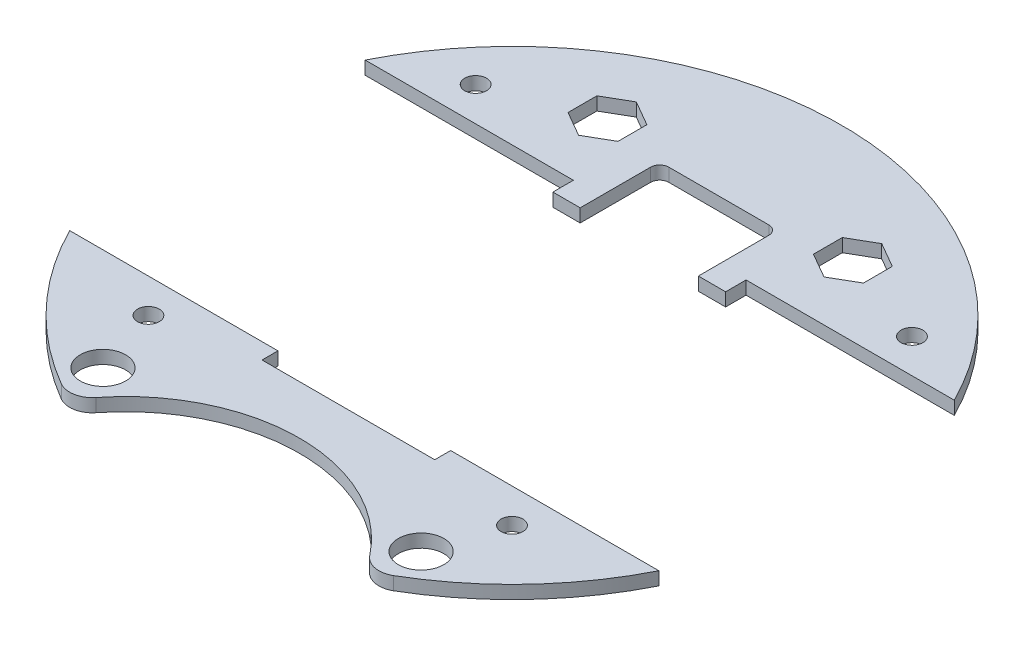
from build123d import *

# Parameters (mm, degrees)
BOSS_EXTRUDE1_DEPTH  = 2.9
SOLENOID_PLACEMENT_W = 38
SOLENOID_PLACEMENT_H = 64
CUT_EXTRUDE1_DEPTH   = 103.571487266
CUT_EXTRUDE5_DEPTH   = 103.571487266
SKETCH6_R            = 2.4
CUT_EXTRUDE6_DEPTH   = 103.571487266
CUT_EXTRUDE3_DEPTH   = 103.571487266
CUT_EXTRUDE7_DEPTH   = 98.286484159
SKETCH8_R            = 5
CUT_EXTRUDE9_DEPTH   = 98.286484159


with BuildPart() as part:
    # Sketch1 → Boss-Extrude1 (new body)
    with BuildSketch(Plane(origin=(0, 0, 0), x_dir=(1, 0, 0), z_dir=(0, 1, 0))):
        with BuildLine():
            ThreePointArc((36.543377003, -62.616544118), (0, 72.5), (-36.543377003, -62.616544118))
            ThreePointArc((-36.543377003, -62.616544118), (-33.085954668, -63.20954405), (-30.089832649, -61.38507948))
            ThreePointArc((-30.089832649, -61.38507948), (0, -46.75), (30.089832649, -61.38507948))
            ThreePointArc((30.089832649, -61.38507948), (33.085954668, -63.20954405), (36.543377003, -62.616544118))
        make_face()
    extrude(amount=BOSS_EXTRUDE1_DEPTH)

    # solenoid placement → Cut-Extrude1 (cut, through all)
    with BuildSketch(Plane(origin=(0, 2.9, 0), x_dir=(1, 0, 0), z_dir=(0, 1, 0))):
        with Locations((0, -4)):
            Rectangle(SOLENOID_PLACEMENT_W, SOLENOID_PLACEMENT_H)
    extrude(amount=-CUT_EXTRUDE1_DEPTH, mode=Mode.SUBTRACT)

    # Sketch5 → Cut-Extrude5 (cut, through all)
    with BuildSketch(Plane(origin=(0, 2.9, 0), x_dir=(1, 0, 0), z_dir=(0, 1, 0))):
        Polygon((-21.5, 51.175426481), (-27, 54.350852961), (-32.5, 51.175426481), (-32.5, 44.824573519), (-27, 41.649147039), (-21.5, 44.824573519), align=None)
        Polygon((21.5, 51.175426481), (21.5, 44.824573519), (27, 41.649147039), (32.5, 44.824573519), (32.5, 51.175426481), (27, 54.350852961), align=None)
    extrude(amount=-CUT_EXTRUDE5_DEPTH, mode=Mode.SUBTRACT)

    # Sketch6 → Cut-Extrude6 (cut, through all)
    with BuildSketch(Plane(origin=(0, 2.9, 0), x_dir=(1, 0, 0), z_dir=(0, 1, 0))):
        with Locations((40, -40)):
            Circle(SKETCH6_R)
        with Locations((-40, -40)):
            Circle(SKETCH6_R)
        with Locations((48, 40)):
            Circle(SKETCH6_R)
        with Locations((-48, 40)):
            Circle(SKETCH6_R)
    extrude(amount=-CUT_EXTRUDE6_DEPTH, mode=Mode.SUBTRACT)

    # Sketch3 → Cut-Extrude3 (cut, through all)
    with BuildSketch(Plane(origin=(0, 2.9, 0), x_dir=(1, 0, 0), z_dir=(0, 1, 0))):
        Polygon((-19, 28), (-19, 32.5), (-72.5, 32.5), (-72.5, -32.5), (72.5, -32.5), (72.5, 32.5), (19, 32.5), (19, 28), align=None)
    extrude(amount=-CUT_EXTRUDE3_DEPTH, mode=Mode.SUBTRACT)


with BuildPart() as cut_extrude3_piece_1:
    # of the separate pieces the step leaves, piece 1, a body of its own (cut_extrude3_pieces)
    add(part.part.solids().sort_by_distance((64.807406984, 0, -32.5))[0])

    # Sketch7 → Cut-Extrude7 (cut, through all)
    with BuildSketch(Plane(origin=(0, 2.9, 0), x_dir=(1, 0, 0), z_dir=(0, 1, 0))):
        with BuildLine():
            Line((13, 28), (13, 43.5))
            ThreePointArc((13, 43.5), (12.414213562, 44.914213562), (11, 45.5))
            Line((11, 45.5), (-11, 45.5))
            ThreePointArc((-11, 45.5), (-12.414213562, 44.914213562), (-13, 43.5))
            Line((-13, 43.5), (-13, 28))
            Line((-13, 28), (13, 28))
        make_face()
    extrude(amount=-CUT_EXTRUDE7_DEPTH, mode=Mode.SUBTRACT)


with BuildPart() as cut_extrude3_piece_2:
    # of the separate pieces the step leaves, piece 2, a body of its own (cut_extrude3_pieces)
    add(part.part.solids().sort_by_distance((-36.543377003, 0, 62.616544118))[0])

    # Sketch8 → Cut-Extrude9 (cut, through all)
    with BuildSketch(Plane.XZ.offset(-2.9)):
        with Locations((35, 55)):
            Circle(SKETCH8_R)
        with Locations((-35, 55)):
            Circle(SKETCH8_R)
    extrude(amount=CUT_EXTRUDE9_DEPTH, mode=Mode.SUBTRACT)


solid = Compound([cut_extrude3_piece_1.part, cut_extrude3_piece_2.part])
